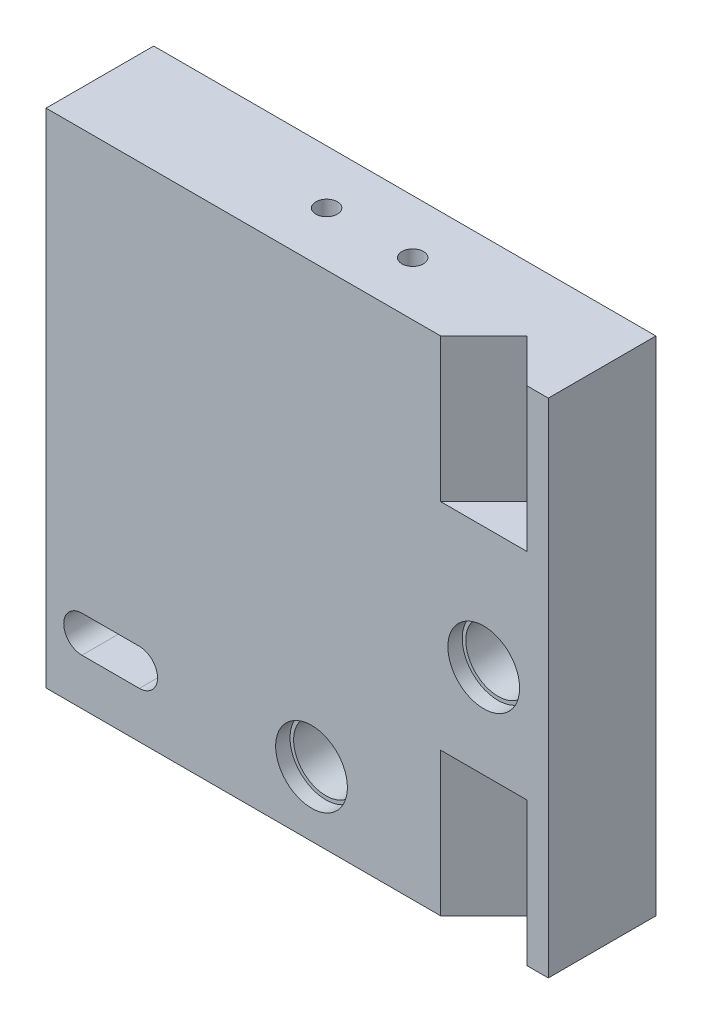
from build123d import *

# Parameters (mm, degrees)
SKETCH1_W           = 35
SKETCH1_H           = 35
BOSS_EXTRUDE1_DEPTH = 7.5
SKETCH2_W           = 24
SKETCH2_H           = 13
CUT_EXTRUDE2_DEPTH  = 5
SKETCH10_R          = 0.75
CUT_EXTRUDE7_DEPTH  = 7
SKETCH5_R           = 2.5
CUT_EXTRUDE11_DEPTH = 1
SKETCH11_R          = 2.25
CUT_EXTRUDE12_DEPTH = 5
CUT_EXTRUDE13_DEPTH = 10
CUT_EXTRUDE14_DEPTH = 10
CUT_EXTRUDE15_DEPTH = 4


with BuildPart() as part:
    # Sketch1 → Boss-Extrude1 (new body)
    with BuildSketch(Plane.XY):
        with Locations((-0.233740073, -3.509910016)):
            Rectangle(SKETCH1_W, SKETCH1_H)
    extrude(amount=BOSS_EXTRUDE1_DEPTH)

    # Sketch2 → Cut-Extrude2 (cut)
    with BuildSketch(Plane(origin=(0, 0, 0), x_dir=(-1, 0, 0), z_dir=(0, 0, -1))):
        with Locations((5.733740073, -3.509910016)):
            Rectangle(SKETCH2_W, SKETCH2_H)
    extrude(amount=-CUT_EXTRUDE2_DEPTH, mode=Mode.SUBTRACT)

    # Sketch10 → Cut-Extrude7 (cut)
    with BuildSketch(Plane(origin=(0, 13.990089984, 0), x_dir=(1, 0, 0), z_dir=(0, 1, 0))):
        with Locations((4.066259927, -3.75)):
            Circle(SKETCH10_R)
        with Locations((-1.933740073, -3.75)):
            Circle(SKETCH10_R)
    extrude(amount=-CUT_EXTRUDE7_DEPTH, mode=Mode.SUBTRACT)

    # Sketch5 → Cut-Extrude11 (cut)
    with BuildSketch(Plane.XY.offset(7.5)):
        with Locations((12.766259927, -4.509910016)):
            Circle(SKETCH5_R)
        with Locations((0.766259927, -16.509910016)):
            Circle(SKETCH5_R)
    extrude(amount=-CUT_EXTRUDE11_DEPTH, mode=Mode.SUBTRACT)

    # Sketch11 → Cut-Extrude12 (cut)
    with BuildSketch(Plane.XY.offset(6.5)):
        with Locations((0.766259927, -16.509910016)):
            Circle(SKETCH11_R)
        with Locations((12.766259927, -4.509910016)):
            Circle(SKETCH11_R)
    extrude(amount=-CUT_EXTRUDE12_DEPTH, mode=Mode.SUBTRACT)

    # Sketch13 → Cut-Extrude13 (cut)
    with BuildSketch(Plane.XZ.offset(21.009910016)):
        Polygon((9.766259927, 7.5), (12.766259927, 4.5), (15.766259927, 7.5), align=None)
    extrude(amount=-CUT_EXTRUDE13_DEPTH, mode=Mode.SUBTRACT)

    # Sketch15 → Cut-Extrude14 (cut)
    with BuildSketch(Plane(origin=(0, 13.990089984, 0), x_dir=(1, 0, 0), z_dir=(0, 1, 0))):
        Polygon((9.766259927, -7.5), (12.766259927, -4.5), (15.766259927, -7.5), align=None)
    extrude(amount=-CUT_EXTRUDE14_DEPTH, mode=Mode.SUBTRACT)

    # Sketch4 → Cut-Extrude15 (cut)
    with BuildSketch(Plane.XY.offset(7.5)):
        with BuildLine():
            Line((-11.233740073, -15.239910016), (-15.233740073, -15.239910016))
            ThreePointArc((-15.233740073, -15.239910016), (-16.503740073, -16.509910016), (-15.233740073, -17.779910016))
            Line((-15.233740073, -17.779910016), (-11.233740073, -17.779910016))
            ThreePointArc((-11.233740073, -17.779910016), (-9.963740073, -16.509910016), (-11.233740073, -15.239910016))
        make_face()
    extrude(amount=-CUT_EXTRUDE15_DEPTH, mode=Mode.SUBTRACT)


solid = part.part
